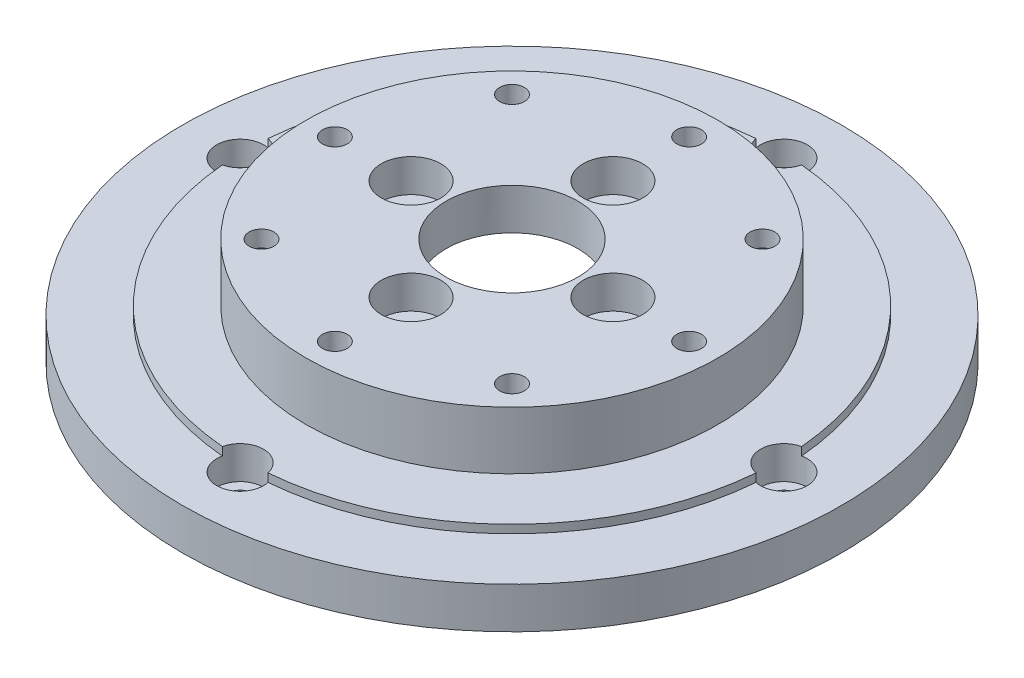
from build123d import *

# Parameters (mm, degrees)
SKETCH1_R           = 40
BOSS_EXTRUDE1_DEPTH = 5
SKETCH4_R           = 32.5
BOSS_EXTRUDE2_DEPTH = 1
SKETCH5_R           = 25
BOSS_EXTRUDE3_DEPTH = 7
SKETCH6_R           = 2
SKETCH6_R_2         = 8
CUT_EXTRUDE1_DEPTH  = 59.043087444
SKETCH7_R           = 30
CUT_EXTRUDE2_DEPTH  = 4
SKETCH8_R           = 24
CUT_EXTRUDE3_DEPTH  = 4
SKETCH9_R           = 3.61
CUT_EXTRUDE4_DEPTH  = 4
SKETCH10_R          = 1.57
CUT_EXTRUDE5_DEPTH  = 59.043087444
SKETCH11_R          = 2.84
CUT_EXTRUDE6_DEPTH  = 4
SKETCH12_R          = 1.5
CUT_EXTRUDE7_DEPTH  = 4
CUT_EXTRUDE9_DEPTH  = 7


with BuildPart() as part:
    # Sketch1 → Boss-Extrude1 (new body)
    with BuildSketch(Plane(origin=(0, 0, 0), x_dir=(1, 0, 0), z_dir=(0, 1, 0))):
        Circle(SKETCH1_R)
    extrude(amount=BOSS_EXTRUDE1_DEPTH)

    # Sketch4 → Boss-Extrude2 (add)
    with BuildSketch(Plane(origin=(0, 5, 0), x_dir=(1, 0, 0), z_dir=(0, 1, 0))):
        Circle(SKETCH4_R)
    extrude(amount=BOSS_EXTRUDE2_DEPTH)

    # Sketch5 → Boss-Extrude3 (add)
    with BuildSketch(Plane(origin=(0, 6, 0), x_dir=(1, 0, 0), z_dir=(0, 1, 0))):
        Circle(SKETCH5_R)
    extrude(amount=BOSS_EXTRUDE3_DEPTH)

    # Sketch6 → Cut-Extrude1 (cut, through all)
    with BuildSketch(Plane(origin=(0, 13, 0), x_dir=(1, 0, 0), z_dir=(0, 1, 0))):
        with Locations((12.25, 0)):
            Circle(SKETCH6_R)
        with Locations((0, -12.25)):
            Circle(SKETCH6_R)
        with Locations((-12.25, 0)):
            Circle(SKETCH6_R)
        with Locations((0, 12.25)):
            Circle(SKETCH6_R)
        Circle(SKETCH6_R_2)
    extrude(amount=-CUT_EXTRUDE1_DEPTH, mode=Mode.SUBTRACT)

    # Sketch7 → Cut-Extrude2 (cut)
    with BuildSketch(Plane.XZ):
        Circle(SKETCH7_R)
    extrude(amount=-CUT_EXTRUDE2_DEPTH, mode=Mode.SUBTRACT)

    # Sketch8 → Cut-Extrude3 (cut)
    with BuildSketch(Plane.XZ.offset(-4)):
        Circle(SKETCH8_R)
    extrude(amount=-CUT_EXTRUDE3_DEPTH, mode=Mode.SUBTRACT)

    # Sketch9 → Cut-Extrude4 (cut)
    with BuildSketch(Plane(origin=(0, 13, 0), x_dir=(1, 0, 0), z_dir=(0, 1, 0))):
        with Locations((0, 12.25)):
            Circle(SKETCH9_R)
        with Locations((12.25, 0)):
            Circle(SKETCH9_R)
        with Locations((0, -12.25)):
            Circle(SKETCH9_R)
        with Locations((-12.25, 0)):
            Circle(SKETCH9_R)
    extrude(amount=-CUT_EXTRUDE4_DEPTH, mode=Mode.SUBTRACT)

    # Sketch10 → Cut-Extrude5 (cut, through all)
    with BuildSketch(Plane(origin=(0, 13, 0), x_dir=(1, 0, 0), z_dir=(0, 1, 0))):
        with Locations((0, 33)):
            Circle(SKETCH10_R)
        with Locations((33, 0)):
            Circle(SKETCH10_R)
        with Locations((0, -33)):
            Circle(SKETCH10_R)
        with Locations((-33, 0)):
            Circle(SKETCH10_R)
    extrude(amount=-CUT_EXTRUDE5_DEPTH, mode=Mode.SUBTRACT)

    # Sketch11 → Cut-Extrude6 (cut)
    with BuildSketch(Plane(origin=(0, 6, 0), x_dir=(1, 0, 0), z_dir=(0, 1, 0))):
        with Locations((0, 33)):
            Circle(SKETCH11_R)
        with Locations((33, 0)):
            Circle(SKETCH11_R)
        with Locations((0, -33)):
            Circle(SKETCH11_R)
        with Locations((-33, 0)):
            Circle(SKETCH11_R)
    extrude(amount=-CUT_EXTRUDE6_DEPTH, mode=Mode.SUBTRACT)

    # Sketch12 → Cut-Extrude7 (cut)
    with BuildSketch(Plane(origin=(0, 13, 0), x_dir=(1, 0, 0), z_dir=(0, 1, 0))):
        with Locations((0, -21.5)):
            Circle(SKETCH12_R)
        with Locations((-15.202795796, -15.202795796)):
            Circle(SKETCH12_R)
        with Locations((-21.5, 0)):
            Circle(SKETCH12_R)
        with Locations((-15.202795796, 15.202795796)):
            Circle(SKETCH12_R)
        with Locations((0, 21.5)):
            Circle(SKETCH12_R)
        with Locations((15.202795796, 15.202795796)):
            Circle(SKETCH12_R)
        with Locations((21.5, 0)):
            Circle(SKETCH12_R)
        with Locations((15.202795796, -15.202795796)):
            Circle(SKETCH12_R)
    extrude(amount=-CUT_EXTRUDE7_DEPTH, mode=Mode.SUBTRACT)

    # Sketch13 → Cut-Extrude9 (cut)
    with BuildSketch(Plane.XZ.offset(-4)):
        Polygon((15.202795796, -11.969634288), (12.402795796, -13.586215042), (12.402795796, -16.819376549), (15.202795796, -18.435957303), (18.002795796, -16.819376549), (18.002795796, -13.586215042), align=None)
        Polygon((-15.202795796, 11.969634288), (-12.402795796, 13.586215042), (-12.402795796, 16.819376549), (-15.202795796, 18.435957303), (-18.002795796, 16.819376549), (-18.002795796, 13.586215042), align=None)
    extrude(amount=-CUT_EXTRUDE9_DEPTH, mode=Mode.SUBTRACT)


solid = part.part
